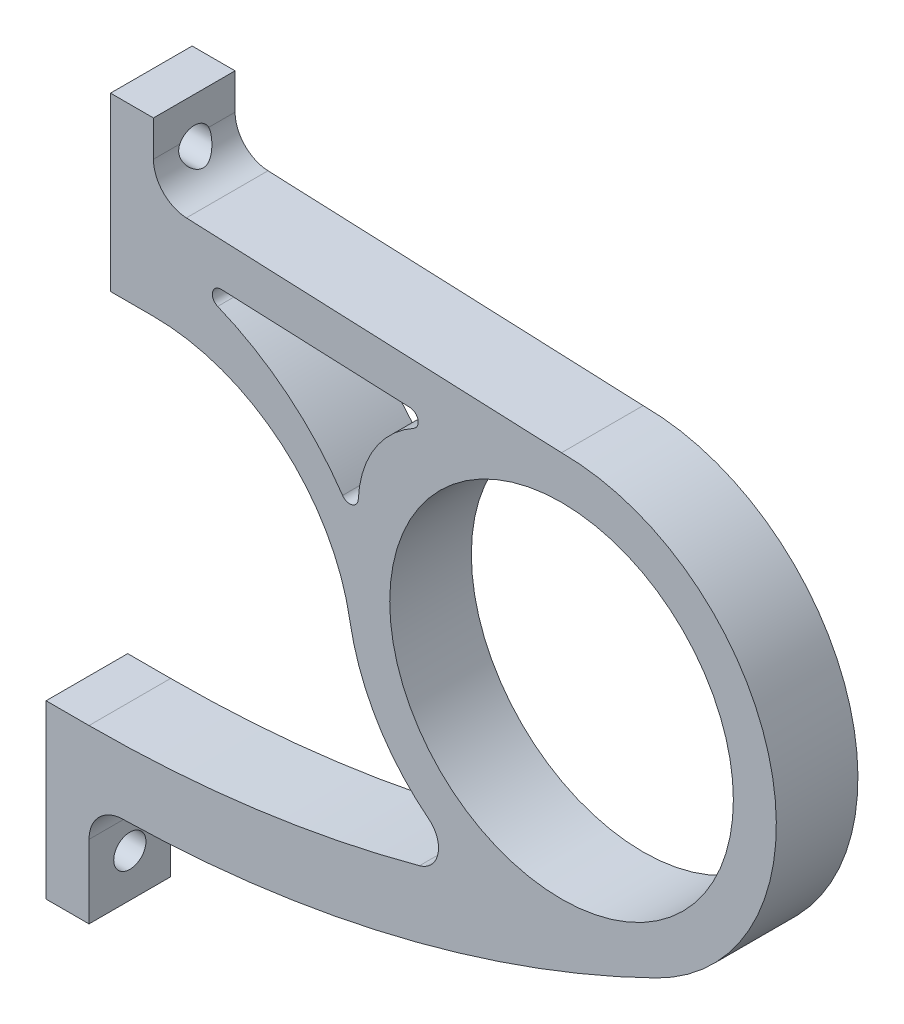
from build123d import *

# Parameters (mm, degrees)
SKETCH1_R           = 50.8
BOSS_EXTRUDE1_DEPTH = 24.13
FILLET1_R           = 10.16
FILLET2_R           = 2.54
FILLET3_R           = 7.62
SKETCH2_R           = 4.7625
CUT_EXTRUDE1_DEPTH  = 252.642737


with BuildPart() as part:
    # Sketch1 → Boss-Extrude1 (new body)
    with BuildSketch(Plane.XY):
        with BuildLine():
            Line((-133.35, 88.9), (-133.35, 38.1))
            Line((-133.35, 38.1), (-120.65, 38.1))
            ThreePointArc((-120.65, 38.1), (-82.687256, 24.244821), (-62.573744, -10.806321))
            ThreePointArc((-62.573744, -10.806321), (-49.896342, -39.276011), (-25.200511, -58.285369))
            ThreePointArc((-25.200511, -58.285369), (-81.75376, -71.694263), (-139.7, -76.2))
            Line((-139.7, -76.2), (-152.4, -76.2))
            Line((-152.4, -76.2), (-152.4, -127))
            Line((-152.4, -127), (-139.7, -127))
            Line((-139.7, -127), (-139.7, -95.25))
            ThreePointArc((-139.7, -95.25), (-53.658629, -85.877954), (27.94, -57.022859))
            ThreePointArc((27.94, -57.022859), (61.859524, 14.340476), (0, 63.5))
            Line((0, 63.5), (-120.65, 68.58))
            Line((-120.65, 68.58), (-120.65, 88.9))
            Line((-120.65, 88.9), (-133.35, 88.9))
        make_face()
        Circle(SKETCH1_R, mode=Mode.SUBTRACT)
        with BuildLine():
            Line((-26.787302, 51.916634), (-129.54, 56.243063))
            ThreePointArc((-129.54, 56.243063), (-86.447642, 41.940834), (-57.421084, 7.027169))
            ThreePointArc((-57.421084, 7.027169), (-54.571217, 37.979735), (-26.787302, 51.916634))
        make_face(mode=Mode.SUBTRACT)
    extrude(amount=BOSS_EXTRUDE1_DEPTH)

    # Fillet1
    fillet1_edges = [part.edges().sort_by_distance(p)[0] for p in [
        (-139.7, -95.25, 12.065),
        (-120.65, 68.58, 12.065),
    ]]
    fillet(fillet1_edges, radius=FILLET1_R)

    # Fillet2
    fillet2_edges = [part.edges().sort_by_distance(p)[0] for p in [
        (-57.421084, 7.027169, 12.065),
        (-26.787302, 51.916634, 12.065),
        (-129.54, 56.243063, 12.065),
    ]]
    fillet(fillet2_edges, radius=FILLET2_R)

    # Fillet3
    fillet3_edges = [part.edges().sort_by_distance(p)[0] for p in [
        (-25.200511, -58.285369, 12.065),
    ]]
    fillet(fillet3_edges, radius=FILLET3_R)

    # Sketch2 → Cut-Extrude1 (cut, through all)
    with BuildSketch(Plane.ZY.offset(152.4)):
        with Locations((12.065, -114.3)):
            Circle(SKETCH2_R)
        with Locations((12.065, 76.2)):
            Circle(SKETCH2_R)
    extrude(amount=-CUT_EXTRUDE1_DEPTH, mode=Mode.SUBTRACT)


solid = part.part
